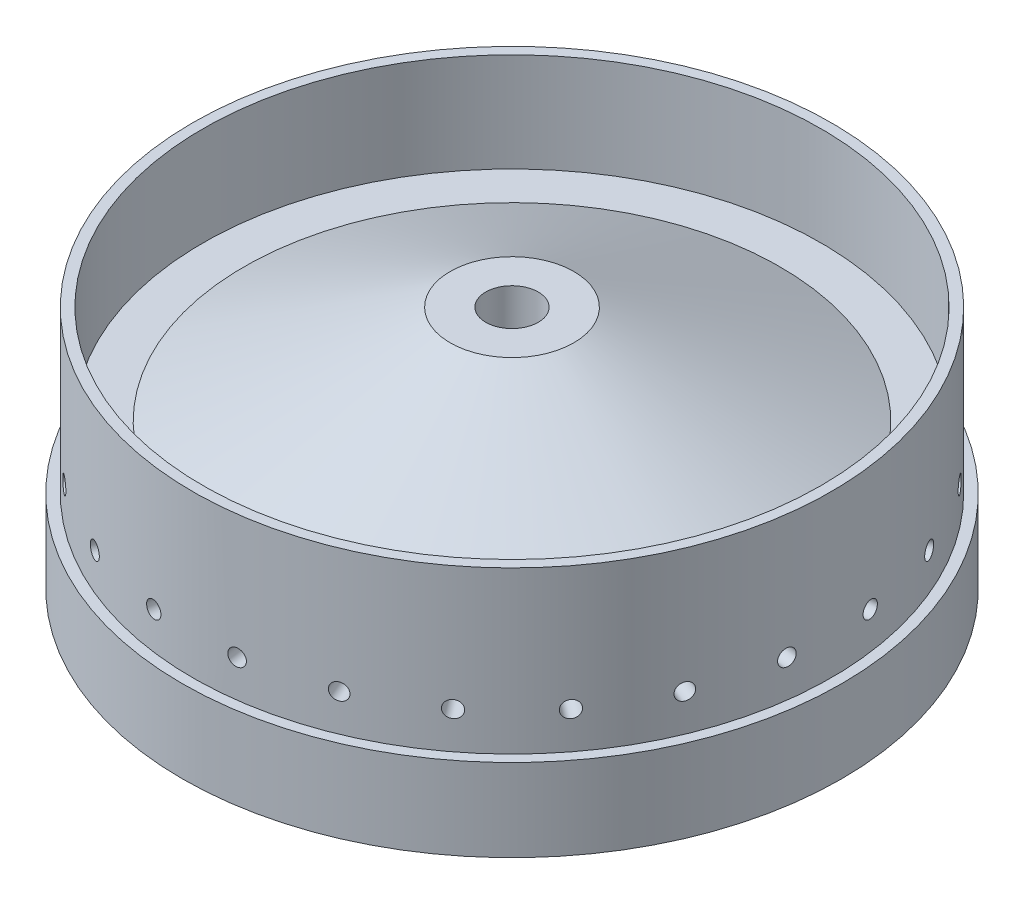
from build123d import *

# Parameters (mm, degrees)
CUT_EXTRUDE2_START    = 25.4
SKETCH3_R             = 101.6
SKETCH3_R_2           = 98.425
CUT_EXTRUDE2_DEPTH    = 137.721683857
CIRPATTERN1_COUNT     = 24
BODY_MOVE_COPY1_ANGLE = 90


with BuildPart() as part:
    # Sketch1 → Revolve1 (revolve)
    with BuildSketch(Plane(origin=(0, 0, 0), x_dir=(1, 0, 0), z_dir=(0, 1, 0))):
        with BuildLine():
            add(Edge.make_bspline(
                [(95.25, 0), (95.25, 54.633955198), (8.09625, 59.277841389)],
                knots=[3.141592654, 3.141592654, 3.141592654, 4.627286292, 4.627286292, 4.627286292], degree=2, weights=[1, 0.736545993, 1]))
            Line((95.25, 0), (101.6, 0))
            Line((101.6, 0), (101.6, 59.49315))
            Line((101.6, 59.49315), (101.6, 75.08875))
            Line((101.6, 75.08875), (95.25, 75.08875))
            Line((95.25, 75.08875), (95.25, 44.60875))
            Line((95.25, 44.60875), (82.55, 44.60875))
            Line((82.55, 44.60875), (19.05, 75.08875))
            Line((19.05, 75.08875), (8.09625, 75.08875))
            Line((8.09625, 75.08875), (8.09625, 59.277841389))
        make_face()
    revolve(axis=Axis((0, 0, 0), (0, 0, -1)))

    # Sketch3 → Cut-Extrude2 (cut, through all)
    with BuildSketch(Plane(origin=(0, 0, 0), x_dir=(-1, 0, 0), z_dir=(0, 0, -1)).offset(CUT_EXTRUDE2_START)):
        Circle(SKETCH3_R)
        Circle(SKETCH3_R_2, mode=Mode.SUBTRACT)
    extrude(amount=CUT_EXTRUDE2_DEPTH, mode=Mode.SUBTRACT)

    # Sketch10 → 1/4-20 Tapped Hole1 (revolve, cut)
    with BuildSketch(Plane(origin=(97.582960481, 12.847040469, -36.83), x_dir=(-0.13052619222004497, 0.9914448613738113, 0), z_dir=(0, 0, 1))):
        Polygon((0, 0), (0, 14.233816902), (2.5527, 12.7), (2.5527, 0), align=None)
    f_1_4_20_tapped_hole1 = revolve(axis=Axis((103.87863535, 13.67588179, -36.83), (-0.9914448613738113, -0.13052619222004497, 0)), mode=Mode.SUBTRACT)

    # CirPattern1: 1/4-20 Tapped Hole1 ×24 about axis
    cirpattern1_axis = Axis((0, 0, 0), (0, 0, 1))
    for i in range(1, CIRPATTERN1_COUNT):
        add(f_1_4_20_tapped_hole1.rotate(cirpattern1_axis, i * 360 / CIRPATTERN1_COUNT), mode=Mode.SUBTRACT)


with BuildPart() as part_1:
    # Body-Move/Copy1: moved
    add(part.part.rotate(Axis((0, 0, -37.544375), (1, 0, 0)), BODY_MOVE_COPY1_ANGLE))


solid = part_1.part
